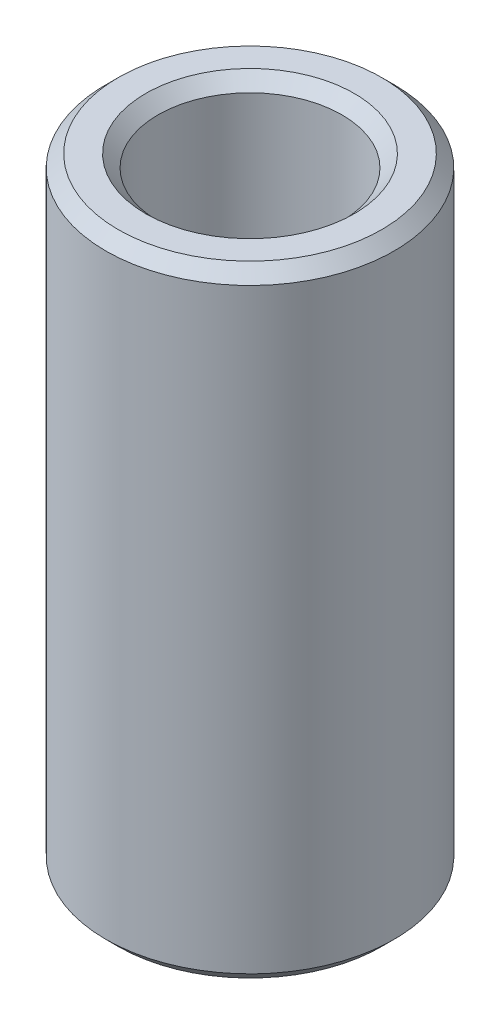
from build123d import *

# Parameters (mm, degrees)
SKETCH1_R           = 30
BOSS_EXTRUDE1_DEPTH = 129.245161771
SKETCH2_R           = 19.13583401
CUT_EXTRUDE1_DEPTH  = 137.030554807
CHAMFER1_SIZE       = 2.569422135


with BuildPart() as part:
    # Sketch1 → Boss-Extrude1 (new body)
    with BuildSketch(Plane(origin=(0, 0, 0), x_dir=(1, 0, 0), z_dir=(0, 1, 0))):
        Circle(SKETCH1_R)
    extrude(amount=BOSS_EXTRUDE1_DEPTH)

    # Sketch2 → Cut-Extrude1 (cut, through all)
    with BuildSketch(Plane(origin=(0, 0, 0), x_dir=(1, 0, 0), z_dir=(0, 1, 0))):
        Circle(SKETCH2_R)
    extrude(amount=CUT_EXTRUDE1_DEPTH, mode=Mode.SUBTRACT)

    # Chamfer1
    chamfer1_edges = [part.edges().sort_by_distance(p)[0] for p in [
        (-19.13583401, 129.245161771, 0),
        (-19.13583401, 0, 0),
        (-30, 0, 0),
        (-30, 129.245161771, 0),
    ]]
    chamfer(chamfer1_edges, length=CHAMFER1_SIZE)


solid = part.part
